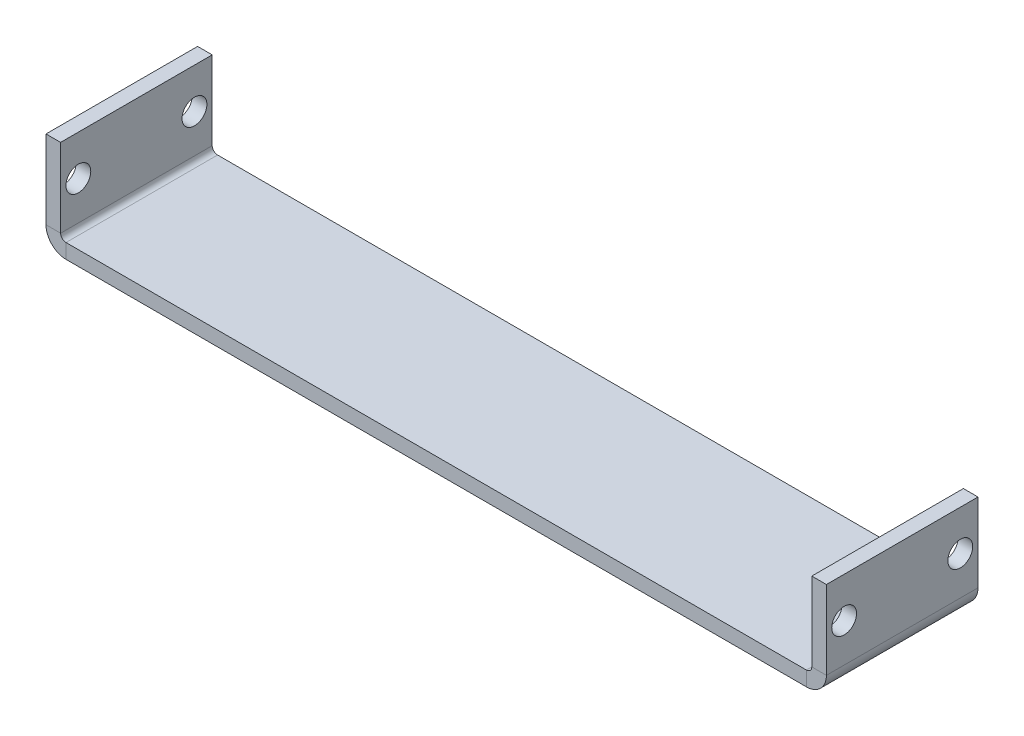
from build123d import *

# Parameters (mm, degrees)
SKETCH_2_W             = 128.39072245
SKETCH_2_H             = 20.758785388
SKETCH_2_R             = 1.7
SM_BASE_FLANGE_1_DEPTH = 2
OTHER_START            = -15.144216699
OTHER_1_DEPTH          = 20.758785388
OTHER_START_2          = -11.014823905
OTHER_1_2_DEPTH        = 12.4999998
OTHER_1_3_DEPTH        = 0.729392594
OTHER_START_3          = 4.885176095
OTHER_1_4_DEPTH        = 0.729392594
OTHER_START_4          = -14.414824105
OTHER_1_5_DEPTH        = 19.3000002
OTHER_START_5          = -109.217240912
OTHER_1_6_OUTLINE_R    = 1.7
OTHER_1_6_DEPTH        = 106.86392245


with BuildPart() as part:
    # 基体-法兰1: sheet metal written as solids
    # Sketch 2 → 基体-法兰1 (new body)
    with BuildSketch(Plane(origin=(0, 0, 0), x_dir=(1, 0, 0), z_dir=(0, 1, 0))):
        with Locations((-55.785279687, 4.764824005)):
            Rectangle(SKETCH_2_W, SKETCH_2_H)
        with Locations(Location((2.910081538, 12.714824005, 0), (0, 0, 270))):
            Circle(SKETCH_2_R, mode=Mode.SUBTRACT)
        with Locations(Location((2.910081538, -3.185175995, 0), (0, 0, 270))):
            Circle(SKETCH_2_R, mode=Mode.SUBTRACT)
        with Locations(Location((-114.480640912, -3.185175995, 0), (0, 0, 90))):
            Circle(SKETCH_2_R, mode=Mode.SUBTRACT)
        with Locations(Location((-114.480640912, 12.714824005, 0), (0, 0, 90))):
            Circle(SKETCH_2_R, mode=Mode.SUBTRACT)
    extrude(amount=-SM_BASE_FLANGE_1_DEPTH)

    # Other 1: read off the stored shape, not the designer's step
    # Other 1 outline → Other 1 (cut)
    with BuildSketch(Plane.XY.offset(OTHER_START)):
        with BuildLine():
            Line((-119.980640912, -2), (-106.480640912, -2))
            ThreePointArc((-106.480640912, -2), (-108.134908121, -1.443395312), (-109.11624331, 0))
            Line((-109.11624331, 0), (-119.980640912, 0))
            Line((-119.980640912, 0), (-119.980640912, -2))
        make_face()
        with BuildLine():
            ThreePointArc((-2.454316064, 0), (-3.435651253, -1.443395312), (-5.089918462, -2))
            Line((-5.089918462, -2), (8.410081538, -2))
            Line((8.410081538, -2), (8.410081538, 0))
            Line((8.410081538, 0), (-2.454316064, 0))
        make_face()
    extrude(amount=OTHER_1_DEPTH, mode=Mode.SUBTRACT)

    # Other 1 2 outline → Other 1 2 (add)
    with BuildSketch(Plane.XY.offset(OTHER_START_2)):
        with BuildLine():
            ThreePointArc((-109.217240912, 0.7366), (-109.191873941, 0.364854094), (-109.11624331, 0))
            Line((-109.11624331, 0), (-106.480640912, 0))
            ThreePointArc((-106.480640912, 0), (-107.001495767, 0.215745145), (-107.217240912, 0.7366))
            Line((-107.217240912, 0.7366), (-107.217240912, 11.508755099))
            Line((-107.217240912, 11.508755099), (-109.217240912, 11.508755099))
            Line((-109.217240912, 11.508755099), (-109.217240912, 0.7366))
        make_face()
        with BuildLine():
            Line((-5.089918462, 0), (-2.454316064, 0))
            ThreePointArc((-2.454316064, 0), (-2.378685433, 0.364854094), (-2.353318462, 0.7366))
            Line((-2.353318462, 0.7366), (-2.353318462, 11.508755099))
            Line((-2.353318462, 11.508755099), (-4.353318462, 11.508755099))
            Line((-4.353318462, 11.508755099), (-4.353318462, 0.7366))
            ThreePointArc((-4.353318462, 0.7366), (-4.569063607, 0.215745145), (-5.089918462, 0))
        make_face()
    extrude(amount=OTHER_1_2_DEPTH)

    # Other 1 3 outline → Other 1 3 (add)
    with BuildSketch(Plane.XY.offset(OTHER_START)):
        with BuildLine():
            ThreePointArc((-109.217240912, 0.7366), (-109.191873941, 0.364854094), (-109.11624331, 0))
            Line((-109.11624331, 0), (-106.480640912, 0))
            ThreePointArc((-106.480640912, 0), (-107.001495767, 0.215745145), (-107.217240912, 0.7366))
            Line((-107.217240912, 0.7366), (-107.217240912, 11.508755099))
            Line((-107.217240912, 11.508755099), (-109.217240912, 11.508755099))
            Line((-109.217240912, 11.508755099), (-109.217240912, 0.7366))
        make_face()
        with BuildLine():
            Line((-5.089918462, 0), (-2.454316064, 0))
            ThreePointArc((-2.454316064, 0), (-2.378685433, 0.364854094), (-2.353318462, 0.7366))
            Line((-2.353318462, 0.7366), (-2.353318462, 11.508755099))
            Line((-2.353318462, 11.508755099), (-4.353318462, 11.508755099))
            Line((-4.353318462, 11.508755099), (-4.353318462, 0.7366))
            ThreePointArc((-4.353318462, 0.7366), (-4.569063607, 0.215745145), (-5.089918462, 0))
        make_face()
    extrude(amount=OTHER_1_3_DEPTH)

    # Other 1 4 outline → Other 1 4 (add)
    with BuildSketch(Plane.XY.offset(OTHER_START_3)):
        with BuildLine():
            ThreePointArc((-109.217240912, 0.7366), (-109.191873941, 0.364854094), (-109.11624331, 0))
            Line((-109.11624331, 0), (-106.480640912, 0))
            ThreePointArc((-106.480640912, 0), (-107.001495767, 0.215745145), (-107.217240912, 0.7366))
            Line((-107.217240912, 0.7366), (-107.217240912, 11.508755099))
            Line((-107.217240912, 11.508755099), (-109.217240912, 11.508755099))
            Line((-109.217240912, 11.508755099), (-109.217240912, 0.7366))
        make_face()
        with BuildLine():
            Line((-5.089918462, 0), (-2.454316064, 0))
            ThreePointArc((-2.454316064, 0), (-2.378685433, 0.364854094), (-2.353318462, 0.7366))
            Line((-2.353318462, 0.7366), (-2.353318462, 11.508755099))
            Line((-2.353318462, 11.508755099), (-4.353318462, 11.508755099))
            Line((-4.353318462, 11.508755099), (-4.353318462, 0.7366))
            ThreePointArc((-4.353318462, 0.7366), (-4.569063607, 0.215745145), (-5.089918462, 0))
        make_face()
    extrude(amount=OTHER_1_4_DEPTH)

    # Other 1 5 outline → Other 1 5 (add)
    with BuildSketch(Plane.XY.offset(OTHER_START_4)):
        with BuildLine():
            ThreePointArc((-4.353318462, 0.7366), (-4.569063607, 0.215745145), (-5.089918462, 0))
            Line((-5.089918462, 0), (-2.454316064, 0))
            ThreePointArc((-2.454316064, 0), (-2.378685433, 0.364854094), (-2.353318462, 0.7366))
            Line((-2.353318462, 0.7366), (-2.353318462, 11.508755099))
            Line((-2.353318462, 11.508755099), (-4.353318462, 11.508755099))
            Line((-4.353318462, 11.508755099), (-4.353318462, 0.7366))
        make_face()
        with BuildLine():
            ThreePointArc((-109.217240912, 0.7366), (-109.191873941, 0.364854094), (-109.11624331, 0))
            Line((-109.11624331, 0), (-106.480640912, 0))
            ThreePointArc((-106.480640912, 0), (-107.001495767, 0.215745145), (-107.217240912, 0.7366))
            Line((-107.217240912, 0.7366), (-107.217240912, 11.508755099))
            Line((-107.217240912, 11.508755099), (-109.217240912, 11.508755099))
            Line((-109.217240912, 11.508755099), (-109.217240912, 0.7366))
        make_face()
    extrude(amount=OTHER_1_5_DEPTH)

    # Other 1 6 outline → Other 1 6 (cut)
    with BuildSketch(Plane.YZ.offset(OTHER_START_5)):
        with Locations((6.008755099, -12.714824005)):
            Circle(OTHER_1_6_OUTLINE_R)
        with Locations((6.008755099, 3.185175995)):
            Circle(OTHER_1_6_OUTLINE_R)
    extrude(amount=OTHER_1_6_DEPTH, mode=Mode.SUBTRACT)


solid = part.part
